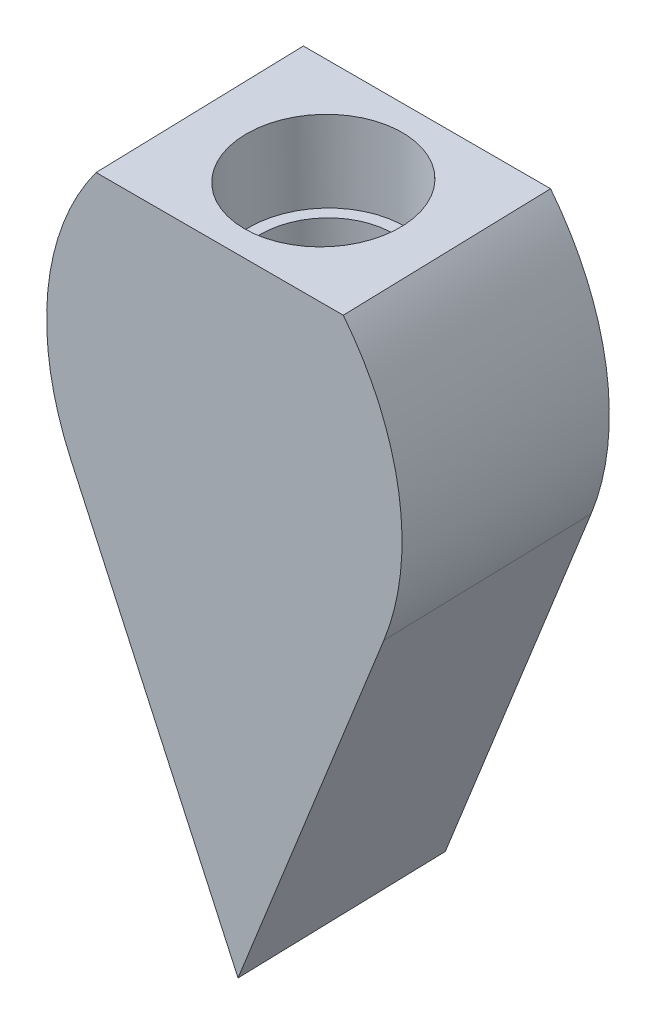
from build123d import *

# Parameters (mm, degrees)
BOSS_EXTRUDE1_DEPTH      = 4.35
BOSS_EXTRUDE1_DEPTH_BACK = 3.2
SKETCH4_R                = 2.45
CUT_EXTRUDE2_DEPTH       = 10
SKETCH4_5_R              = 2.875
SKETCH4_5_R_2            = 2.45
CUT_EXTRUDE3_DEPTH       = 3
FILLET1_R                = 10
BOSS_EXTRUDE2_DEPTH      = 7.55


with BuildPart() as part:
    # Sketch2 → Boss-Extrude1 (new, two sides: drawn at the far end of the back side and taken through both)
    with BuildSketch(Plane(origin=(0, 0.021487422, -0.580480419), x_dir=(1, 0, 0), z_dir=(0, -0.02843310858496513, 0.9995956974378171)).offset(-BOSS_EXTRUDE1_DEPTH_BACK)):
        Polygon((-13.116179094, 1.214943373), (-10.360421829, -5.408768885), (-2.99346614, -23.115914326), (3.822823349, -23.115914326), (11.189779038, -5.408768885), (13.945536303, 1.214943373), (9.430107454, -3.300485476), (4.914678604, -7.815914326), (-4.085321396, -7.815914326), (-8.600750245, -3.300485476), align=None)
    extrude(amount=BOSS_EXTRUDE1_DEPTH + BOSS_EXTRUDE1_DEPTH_BACK)

    # Sketch4 → Cut-Extrude2 (cut)
    with BuildSketch(Plane(origin=(0, -7.80778247, -0.222089318), x_dir=(1, 0, 0), z_dir=(0, 0.9995956974378171, 0.02843310858496514))):
        with Locations(Location((0.414678604, 0.005856684, 0), (0, 0, 270))):
            Circle(SKETCH4_R)
    extrude(amount=-CUT_EXTRUDE2_DEPTH, mode=Mode.SUBTRACT)

    # Sketch4<5> → Cut-Extrude3 (cut)
    with BuildSketch(Plane(origin=(0, -7.80778247, -0.222089318), x_dir=(1, 0, 0), z_dir=(0, 0.9995956974378171, 0.02843310858496514))):
        with Locations(Location((0.414678604, 0.005856684, 0), (0, 0, 270))):
            Circle(SKETCH4_5_R)
        with Locations(Location((0.414678604, 0.005856684, 0), (0, 0, 270))):
            Circle(SKETCH4_5_R_2, mode=Mode.SUBTRACT)
    extrude(amount=-CUT_EXTRUDE3_DEPTH, mode=Mode.SUBTRACT)

    # Fillet1
    # the kernel refuses this fillet: 10 mm, written as the material it takes off along each edge
    with BuildSketch(Plane(origin=(13.945536303, -0.3371442, 54.757471627), x_dir=(-0.7071067811865475, -0.7068208961031768, -0.020105243890642274), z_dir=(0, 0.028433108584965117, -0.999595697437817)), Plane(origin=(-13.116179094, 2.776325306, -54.69980818), x_dir=(0.7071067811865489, -0.7068208961031754, -0.020105243890642235), z_dir=(0, -0.028433108584965117, 0.999595697437817))) as fillet1_piece_1:
        with BuildLine():
            CenterArc((22.662755022, 1.47115243), FILLET1_R, 188.459787479, 59.129683347)
            Line((18.850352296, -7.773607462), (0, 0))
            Line((0, 0), (12.771561437, 0))
        make_face()
    extrude(amount=109.501551565, mode=Mode.SUBTRACT)

    # Sketch6 → Boss-Extrude2 (add)
    with BuildSketch(Plane(origin=(0, -0.107168461, 3.767619442), x_dir=(1, 0, 0), z_dir=(0, -0.02843310858496513, 0.9995956974378171))):
        Polygon((-2.99346614, -23.110940453), (0.414678604, -31.302725123), (3.822823349, -23.110940453), align=None)
    extrude(amount=-BOSS_EXTRUDE2_DEPTH)


solid = part.part
